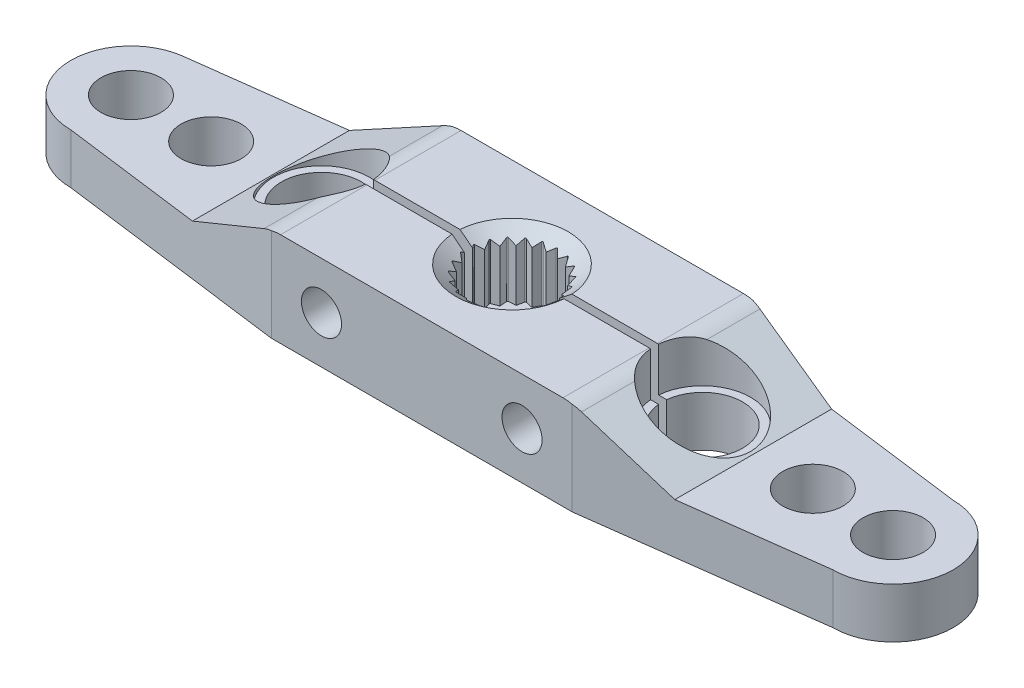
from build123d import *

# Parameters (mm, degrees)
SKETCH1_R           = 1.5
SKETCH1_R_2         = 2
BOSS_EXTRUDE1_DEPTH = 2.5
SKETCH3_W           = 15
SKETCH3_H           = 9
BOSS_EXTRUDE2_DEPTH = 2.2
BOSS_EXTRUDE3_REACH = 27.12
SKETCH8_R           = 2.4
CUT_EXTRUDE1_DEPTH  = 23.958483941
BOSS_EXTRUDE4_REACH = 27.75
SKETCH10_R          = 2.4
CUT_EXTRUDE2_DEPTH  = 2.5
CUT_EXTRUDE5_START  = -1
SKETCH18_R          = 1.5
CUT_EXTRUDE5_DEPTH  = 1
FILLET2_START       = -5
FILLET2_DEPTH       = 10
CUT_EXTRUDE3_DEPTH  = 24.300900965
SKETCH15_R          = 1
CUT_EXTRUDE4_DEPTH  = 25.569940733


with BuildPart() as part:
    # Sketch1 → Boss-Extrude1 (new body)
    with BuildSketch(Plane(origin=(0, 0, 0), x_dir=(1, 0, 0), z_dir=(0, 1, 0))):
        with BuildLine():
            Line((-7.873913043, 4.5), (7.126086957, 4.5))
            Line((7.126086957, 4.5), (18.626086957, 3))
            ThreePointArc((18.626086957, 3), (21.626086957, 0), (18.626086957, -3))
            Line((18.626086957, -3), (7.126086957, -4.5))
            Line((7.126086957, -4.5), (-7.873913043, -4.5))
            Line((-7.873913043, -4.5), (-19.373913043, -3))
            ThreePointArc((-19.373913043, -3), (-22.367809499, -0.191269486), (-19.755673735, 2.975610656))
            Line((-19.755673735, 2.975610656), (-7.873913043, 4.5))
        make_face()
        with Locations(Location((18.626086957, 0, 0), (0, 0, 270))):
            Circle(SKETCH1_R, mode=Mode.SUBTRACT)
        with Locations(Location((14.626086957, 0, 0), (0, 0, 270))):
            Circle(SKETCH1_R, mode=Mode.SUBTRACT)
        with Locations(Location((9.126086957, 0, 0), (0, 0, 270))):
            Circle(SKETCH1_R_2, mode=Mode.SUBTRACT)
        with Locations(Location((-9.873913043, 0, 0), (0, 0, 90))):
            Circle(SKETCH1_R_2, mode=Mode.SUBTRACT)
        with Locations(Location((-15.373913043, 0, 0), (0, 0, 90))):
            Circle(SKETCH1_R, mode=Mode.SUBTRACT)
        with Locations(Location((-19.373913043, 0, 0), (0, 0, 90))):
            Circle(SKETCH1_R, mode=Mode.SUBTRACT)
        with Locations(Location((-0.373913043, 0, 0), (0, 0, 270))):
            Circle(SKETCH1_R, mode=Mode.SUBTRACT)
    extrude(amount=BOSS_EXTRUDE1_DEPTH)

    # Sketch3 → Boss-Extrude2 (add)
    with BuildSketch(Plane(origin=(0, 2.5, 0), x_dir=(1, 0, 0), z_dir=(0, 1, 0))):
        with Locations((-0.373913043, 0)):
            Rectangle(SKETCH3_W, SKETCH3_H)
        with BuildLine():
            Line((-0.338557704, -2.239644661), (-0.087934877, -1.989021834))
            Line((-0.087934877, -1.989021834), (0.223144574, -2.158884066))
            ThreePointArc((0.223144574, -2.158884066), (0.261193651, -2.162974765), (0.290990973, -2.138962565))
            Line((0.290990973, -2.138962565), (0.460853204, -1.827883114))
            Line((0.460853204, -1.827883114), (0.807187473, -1.903223523))
            ThreePointArc((0.807187473, -1.903223523), (0.844847778, -1.896428856), (0.866673081, -1.864994444))
            Line((0.866673081, -1.864994444), (0.942013489, -1.518660175))
            Line((0.942013489, -1.518660175), (1.295544632, -1.493375129))
            ThreePointArc((1.295544632, -1.493375129), (1.329765152, -1.47624556), (1.341850279, -1.439935564))
            Line((1.341850279, -1.439935564), (1.316565233, -1.086404421))
            Line((1.316565233, -1.086404421), (1.64865226, -0.962542364))
            ThreePointArc((1.64865226, -0.962542364), (1.67666065, -0.936465628), (1.678026537, -0.898221668))
            Line((1.678026537, -0.898221668), (1.55416448, -0.566134641))
            Line((1.55416448, -0.566134641), (1.837903675, -0.35373014))
            ThreePointArc((1.837903675, -0.35373014), (1.857430864, -0.32081882), (1.847966853, -0.283739195))
            Line((1.847966853, -0.283739195), (1.635562353, 0))
            Line((1.635562353, 0), (1.847966853, 0.283739195))
            ThreePointArc((1.847966853, 0.283739195), (1.857430864, 0.32081882), (1.837903675, 0.35373014))
            Line((1.837903675, 0.35373014), (1.55416448, 0.566134641))
            Line((1.55416448, 0.566134641), (1.678026537, 0.898221668))
            ThreePointArc((1.678026537, 0.898221668), (1.67666065, 0.936465628), (1.64865226, 0.962542364))
            Line((1.64865226, 0.962542364), (1.316565233, 1.086404421))
            Line((1.316565233, 1.086404421), (1.341850279, 1.439935564))
            ThreePointArc((1.341850279, 1.439935564), (1.329765152, 1.47624556), (1.295544632, 1.493375129))
            Line((1.295544632, 1.493375129), (0.942013489, 1.518660175))
            Line((0.942013489, 1.518660175), (0.866673081, 1.864994444))
            ThreePointArc((0.866673081, 1.864994444), (0.844847778, 1.896428856), (0.807187473, 1.903223523))
            Line((0.807187473, 1.903223523), (0.460853204, 1.827883114))
            Line((0.460853204, 1.827883114), (0.290990973, 2.138962565))
            ThreePointArc((0.290990973, 2.138962565), (0.261193651, 2.162974765), (0.223144574, 2.158884066))
            Line((0.223144574, 2.158884066), (-0.087934877, 1.989021834))
            Line((-0.087934877, 1.989021834), (-0.338557704, 2.239644661))
            ThreePointArc((-0.338557704, 2.239644661), (-0.373913043, 2.254289322), (-0.409268383, 2.239644661))
            Line((-0.409268383, 2.239644661), (-0.659891209, 1.989021834))
            Line((-0.659891209, 1.989021834), (-0.970970661, 2.158884066))
            ThreePointArc((-0.970970661, 2.158884066), (-1.009019738, 2.162974765), (-1.03881706, 2.138962565))
            Line((-1.03881706, 2.138962565), (-1.208679291, 1.827883114))
            Line((-1.208679291, 1.827883114), (-1.55501356, 1.903223523))
            ThreePointArc((-1.55501356, 1.903223523), (-1.592673865, 1.896428856), (-1.614499168, 1.864994444))
            Line((-1.614499168, 1.864994444), (-1.689839576, 1.518660175))
            Line((-1.689839576, 1.518660175), (-2.043370719, 1.493375129))
            ThreePointArc((-2.043370719, 1.493375129), (-2.077591239, 1.47624556), (-2.089676366, 1.439935564))
            Line((-2.089676366, 1.439935564), (-2.06439132, 1.086404421))
            Line((-2.06439132, 1.086404421), (-2.396478347, 0.962542364))
            ThreePointArc((-2.396478347, 0.962542364), (-2.424486737, 0.936465628), (-2.425852624, 0.898221668))
            Line((-2.425852624, 0.898221668), (-2.301990567, 0.566134641))
            Line((-2.301990567, 0.566134641), (-2.585729762, 0.35373014))
            ThreePointArc((-2.585729762, 0.35373014), (-2.60525695, 0.32081882), (-2.59579294, 0.283739195))
            Line((-2.59579294, 0.283739195), (-2.38338844, 0))
            Line((-2.38338844, 0), (-2.59579294, -0.283739195))
            ThreePointArc((-2.59579294, -0.283739195), (-2.60525695, -0.32081882), (-2.585729762, -0.35373014))
            Line((-2.585729762, -0.35373014), (-2.301990567, -0.566134641))
            Line((-2.301990567, -0.566134641), (-2.425852624, -0.898221668))
            ThreePointArc((-2.425852624, -0.898221668), (-2.424486737, -0.936465628), (-2.396478347, -0.962542364))
            Line((-2.396478347, -0.962542364), (-2.06439132, -1.086404421))
            Line((-2.06439132, -1.086404421), (-2.089676366, -1.439935564))
            ThreePointArc((-2.089676366, -1.439935564), (-2.077591239, -1.47624556), (-2.043370719, -1.493375129))
            Line((-2.043370719, -1.493375129), (-1.689839576, -1.518660175))
            Line((-1.689839576, -1.518660175), (-1.614499168, -1.864994444))
            ThreePointArc((-1.614499168, -1.864994444), (-1.592673865, -1.896428856), (-1.55501356, -1.903223523))
            Line((-1.55501356, -1.903223523), (-1.208679291, -1.827883114))
            Line((-1.208679291, -1.827883114), (-1.03881706, -2.138962565))
            ThreePointArc((-1.03881706, -2.138962565), (-1.009019738, -2.162974765), (-0.970970661, -2.158884066))
            Line((-0.970970661, -2.158884066), (-0.659891209, -1.989021834))
            Line((-0.659891209, -1.989021834), (-0.409268383, -2.239644661))
            ThreePointArc((-0.409268383, -2.239644661), (-0.373913043, -2.254289322), (-0.338557704, -2.239644661))
        make_face(mode=Mode.SUBTRACT)
    extrude(amount=BOSS_EXTRUDE2_DEPTH)

    # Boss-Extrude3: up to this plane
    boss_extrude3_end = Plane(origin=(-7.873913043, 2.5, -4.5), z_dir=(0.12725356379147035, 0, 0.991870218578202))
    # Sketch7 → Boss-Extrude3 (add, up to the surface)
    with BuildSketch(Plane(origin=(-0.708857281, 0, 5.434572491), x_dir=(0.9916004111862218, 0, 0.12933918406776806), z_dir=(-0.12933918406776806, 0, 0.9916004111862218)), mode=Mode.PRIVATE) as boss_extrude3_sk1:
        Polygon((-7.225749083, 2.5), (-7.225749083, 4.7), (-11.790976234, 2.5), align=None)
    boss_extrude3_tool1 = split(extrude(boss_extrude3_sk1.sketch, amount=BOSS_EXTRUDE3_REACH, dir=(0, 0, -1), mode=Mode.PRIVATE), bisect_by=boss_extrude3_end, keep=Keep.BOTH, mode=Mode.PRIVATE)
    add(boss_extrude3_tool1.solids().sort_by_distance((-9.382873, 3.233333, 4.303179))[0])

    # Sketch8 → Cut-Extrude1 (cut, through all)
    with BuildSketch(Plane.XZ.offset(-2.5)):
        with Locations(Location((-9.873913043, 0, 0), (0, 0, 270))):
            Circle(SKETCH8_R)
    extrude(amount=-CUT_EXTRUDE1_DEPTH, mode=Mode.SUBTRACT)

    # Boss-Extrude4: up to this plane
    boss_extrude4_end = Plane(origin=(7.126086957, 2.5, 4.5), z_dir=(-0.1293391840677681, 0, -0.9916004111862218))
    # Sketch9 → Boss-Extrude4 (add, up to the surface)
    with BuildSketch(Plane(origin=(0.69634718, 0, -5.33866171), x_dir=(-0.9916004111862218, 0, -0.12933918406776806), z_dir=(0.12933918406776806, 0, -0.9916004111862218)), mode=Mode.PRIVATE) as boss_extrude4_sk1:
        Polygon((-6.484204428, 2.5), (-6.484204428, 4.7), (-11.049431579, 2.5), align=None)
    boss_extrude4_tool1 = split(extrude(boss_extrude4_sk1.sketch, amount=BOSS_EXTRUDE4_REACH, dir=(0, 0, 1), mode=Mode.PRIVATE), bisect_by=boss_extrude4_end, keep=Keep.BOTH, mode=Mode.PRIVATE)
    add(boss_extrude4_tool1.solids().sort_by_distance((8.635047, 3.233333, -4.303179))[0])

    # Sketch10 → Cut-Extrude2 (cut)
    with BuildSketch(Plane.XZ.offset(-2.5)):
        with Locations(Location((9.126086957, 0, 0), (0, 0, 270))):
            Circle(SKETCH10_R)
    extrude(amount=-CUT_EXTRUDE2_DEPTH, mode=Mode.SUBTRACT)

    # Sketch18 → Cut-Extrude5 (cut)
    with BuildSketch(Plane(origin=(0, 2.5, 0), x_dir=(1, 0, 0), z_dir=(0, 1, 0)).offset(CUT_EXTRUDE5_START)):
        with BuildLine():
            Line((-0.338557704, -2.239644661), (-0.087934877, -1.989021834))
            Line((-0.087934877, -1.989021834), (0.223144574, -2.158884066))
            ThreePointArc((0.223144574, -2.158884066), (0.261193651, -2.162974765), (0.290990973, -2.138962565))
            Line((0.290990973, -2.138962565), (0.460853204, -1.827883114))
            Line((0.460853204, -1.827883114), (0.807187473, -1.903223523))
            ThreePointArc((0.807187473, -1.903223523), (0.844847778, -1.896428856), (0.866673081, -1.864994444))
            Line((0.866673081, -1.864994444), (0.942013489, -1.518660175))
            Line((0.942013489, -1.518660175), (1.295544632, -1.493375129))
            ThreePointArc((1.295544632, -1.493375129), (1.329765152, -1.47624556), (1.341850279, -1.439935564))
            Line((1.341850279, -1.439935564), (1.316565233, -1.086404421))
            Line((1.316565233, -1.086404421), (1.64865226, -0.962542364))
            ThreePointArc((1.64865226, -0.962542364), (1.67666065, -0.936465628), (1.678026537, -0.898221668))
            Line((1.678026537, -0.898221668), (1.55416448, -0.566134641))
            Line((1.55416448, -0.566134641), (1.837903675, -0.35373014))
            ThreePointArc((1.837903675, -0.35373014), (1.857430864, -0.32081882), (1.847966853, -0.283739195))
            Line((1.847966853, -0.283739195), (1.635562353, 0))
            Line((1.635562353, 0), (1.847966853, 0.283739195))
            ThreePointArc((1.847966853, 0.283739195), (1.857430864, 0.32081882), (1.837903675, 0.35373014))
            Line((1.837903675, 0.35373014), (1.55416448, 0.566134641))
            Line((1.55416448, 0.566134641), (1.678026537, 0.898221668))
            ThreePointArc((1.678026537, 0.898221668), (1.67666065, 0.936465628), (1.64865226, 0.962542364))
            Line((1.64865226, 0.962542364), (1.316565233, 1.086404421))
            Line((1.316565233, 1.086404421), (1.341850279, 1.439935564))
            ThreePointArc((1.341850279, 1.439935564), (1.329765152, 1.47624556), (1.295544632, 1.493375129))
            Line((1.295544632, 1.493375129), (0.942013489, 1.518660175))
            Line((0.942013489, 1.518660175), (0.866673081, 1.864994444))
            ThreePointArc((0.866673081, 1.864994444), (0.844847778, 1.896428856), (0.807187473, 1.903223523))
            Line((0.807187473, 1.903223523), (0.460853204, 1.827883114))
            Line((0.460853204, 1.827883114), (0.290990973, 2.138962565))
            ThreePointArc((0.290990973, 2.138962565), (0.261193651, 2.162974765), (0.223144574, 2.158884066))
            Line((0.223144574, 2.158884066), (-0.087934877, 1.989021834))
            Line((-0.087934877, 1.989021834), (-0.338557704, 2.239644661))
            ThreePointArc((-0.338557704, 2.239644661), (-0.373913043, 2.254289322), (-0.409268383, 2.239644661))
            Line((-0.409268383, 2.239644661), (-0.659891209, 1.989021834))
            Line((-0.659891209, 1.989021834), (-0.970970661, 2.158884066))
            ThreePointArc((-0.970970661, 2.158884066), (-1.009019738, 2.162974765), (-1.03881706, 2.138962565))
            Line((-1.03881706, 2.138962565), (-1.208679291, 1.827883114))
            Line((-1.208679291, 1.827883114), (-1.55501356, 1.903223523))
            ThreePointArc((-1.55501356, 1.903223523), (-1.592673865, 1.896428856), (-1.614499168, 1.864994444))
            Line((-1.614499168, 1.864994444), (-1.689839576, 1.518660175))
            Line((-1.689839576, 1.518660175), (-2.043370719, 1.493375129))
            ThreePointArc((-2.043370719, 1.493375129), (-2.077591239, 1.47624556), (-2.089676366, 1.439935564))
            Line((-2.089676366, 1.439935564), (-2.06439132, 1.086404421))
            Line((-2.06439132, 1.086404421), (-2.396478347, 0.962542364))
            ThreePointArc((-2.396478347, 0.962542364), (-2.424486737, 0.936465628), (-2.425852624, 0.898221668))
            Line((-2.425852624, 0.898221668), (-2.301990567, 0.566134641))
            Line((-2.301990567, 0.566134641), (-2.585729762, 0.35373014))
            ThreePointArc((-2.585729762, 0.35373014), (-2.60525695, 0.32081882), (-2.59579294, 0.283739195))
            Line((-2.59579294, 0.283739195), (-2.38338844, 0))
            Line((-2.38338844, 0), (-2.59579294, -0.283739195))
            ThreePointArc((-2.59579294, -0.283739195), (-2.60525695, -0.32081882), (-2.585729762, -0.35373014))
            Line((-2.585729762, -0.35373014), (-2.301990567, -0.566134641))
            Line((-2.301990567, -0.566134641), (-2.425852624, -0.898221668))
            ThreePointArc((-2.425852624, -0.898221668), (-2.424486737, -0.936465628), (-2.396478347, -0.962542364))
            Line((-2.396478347, -0.962542364), (-2.06439132, -1.086404421))
            Line((-2.06439132, -1.086404421), (-2.089676366, -1.439935564))
            ThreePointArc((-2.089676366, -1.439935564), (-2.077591239, -1.47624556), (-2.043370719, -1.493375129))
            Line((-2.043370719, -1.493375129), (-1.689839576, -1.518660175))
            Line((-1.689839576, -1.518660175), (-1.614499168, -1.864994444))
            ThreePointArc((-1.614499168, -1.864994444), (-1.592673865, -1.896428856), (-1.55501356, -1.903223523))
            Line((-1.55501356, -1.903223523), (-1.208679291, -1.827883114))
            Line((-1.208679291, -1.827883114), (-1.03881706, -2.138962565))
            ThreePointArc((-1.03881706, -2.138962565), (-1.009019738, -2.162974765), (-0.970970661, -2.158884066))
            Line((-0.970970661, -2.158884066), (-0.659891209, -1.989021834))
            Line((-0.659891209, -1.989021834), (-0.409268383, -2.239644661))
            ThreePointArc((-0.409268383, -2.239644661), (-0.373913043, -2.254289322), (-0.338557704, -2.239644661))
        make_face()
        with Locations(Location((-0.373913043, 0, 0), (0, 0, 270))):
            Circle(SKETCH18_R, mode=Mode.SUBTRACT)
    extrude(amount=CUT_EXTRUDE5_DEPTH, mode=Mode.SUBTRACT)

    # Sketch13 → Cut-Revolve1 (revolve, cut)
    with BuildSketch(Plane.XY):
        Polygon((-0.373913043, 2.5), (-0.373913043, 4.7), (-3.173913043, 4.7), align=None)
    revolve(axis=Axis((-0.373913043, 2.5, 0), (0, 1, 0)), mode=Mode.SUBTRACT)

    # Fillet2: read off the stored shape, not the designer's step
    # Fillet2 outline → Fillet2 (cut)
    with BuildSketch(Plane.XY.offset(FILLET2_START)):
        with BuildLine():
            ThreePointArc((-8.287866853, 4.498824322), (-7.862189871, 4.649057291), (-7.413663753, 4.7))
            Line((-7.413663753, 4.7), (-7.873913043, 4.7))
            Line((-7.873913043, 4.7), (-8.287866853, 4.498824322))
        make_face()
        with BuildLine():
            ThreePointArc((6.665837666, 4.7), (7.114363784, 4.649057291), (7.540040766, 4.498824322))
            Line((7.540040766, 4.498824322), (7.126086957, 4.7))
            Line((7.126086957, 4.7), (6.665837666, 4.7))
        make_face()
    extrude(amount=FILLET2_DEPTH, mode=Mode.SUBTRACT)

    # Sketch14 → Cut-Extrude3 (cut, through all)
    with BuildSketch(Plane(origin=(0, 4.7, 0), x_dir=(1, 0, 0), z_dir=(0, 1, 0))):
        Polygon((0, 0.2), (-10, 0.2), (-10, -0.2), (0, -0.2), (10, -0.2), (10, 0.2), align=None)
    extrude(amount=-CUT_EXTRUDE3_DEPTH, mode=Mode.SUBTRACT)

    # Sketch15 → Cut-Extrude4 (cut, through all)
    with BuildSketch(Plane.XY.offset(4.5)):
        with Locations((-5.373913043, 2.35)):
            Circle(SKETCH15_R)
        with Locations((4.626086957, 2.35)):
            Circle(SKETCH15_R)
    extrude(amount=-CUT_EXTRUDE4_DEPTH, mode=Mode.SUBTRACT)


solid = part.part
